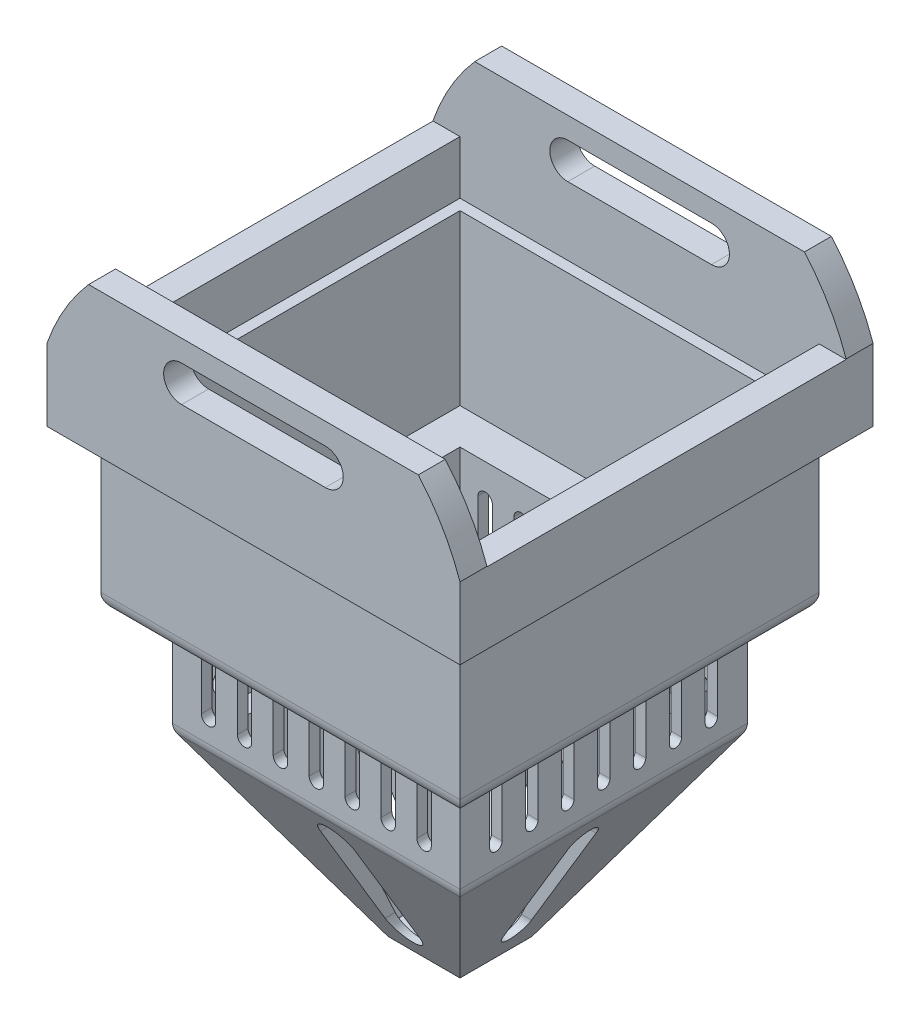
from build123d import *
from OCP.BRepFilletAPI import BRepFilletAPI_MakeChamfer

# Parameters (mm, degrees)
SKETCH4_W                       = 127
SKETCH4_H                       = 127
BOSS_EXTRUDE2_DEPTH             = 57.15
SKETCH4_3_W                     = 146.05
SKETCH4_3_H                     = 146.05
SKETCH4_3_W_2                   = 127
SKETCH4_3_H_2                   = 127
BOSS_EXTRUDE3_DEPTH             = 6.35
SKETCH4_4_W                     = 146.05
SKETCH4_4_H                     = 146.05
SKETCH4_4_W_2                   = 127
SKETCH4_4_H_2                   = 127
BOSS_EXTRUDE4_DEPTH             = 50.8
SKETCH7_W                       = 101.6
SKETCH7_H                       = 101.6
BOSS_EXTRUDE5_DEPTH             = 99.06
CHAMFER1_SIZE                   = 63.5
CHAMFER1_SIZE2                  = 38.1
SKETCH10_W                      = 119.38
SKETCH10_H                      = 119.38
CUT_EXTRUDE2_DEPTH              = 59.69
SKETCH12_W                      = 25.4
SKETCH12_H                      = 25.4
CUT_EXTRUDE3_DEPTH              = 99.06
SKETCH12_3_W                    = 93.98
SKETCH12_3_H                    = 93.98
SKETCH12_3_W_2                  = 25.4
SKETCH12_3_H_2                  = 25.4
CUT_EXTRUDE4_DEPTH              = 38.1
CHAMFER2_SIZE                   = 27.94
CHAMFER2_SIZE_2                 = 60.96
CHAMFER3_SIZE                   = 27.94
CHAMFER3_SIZE_2                 = 60.96
CUT_EXTRUDE6_DEPTH              = 105.918
CUT_EXTRUDE7_DEPTH              = 105.918
FILLET1_R                       = 6.35
CUT_EXTRUDE8_DEPTH              = 105.918
CUT_EXTRUDE9_DEPTH              = 105.918
CUT_EXTRUDE10_REACH             = 227.975
CUT_EXTRUDE10_DIRECTION_2_DEPTH = 226.975257993
CUT_EXTRUDE11_REACH             = 227.975
SKETCH18_W                      = 127
SKETCH18_H                      = 18.879254834
CUT_EXTRUDE12_REACH             = 227.975


with BuildPart() as part:
    # Sketch4 → Boss-Extrude2 (new body)
    with BuildSketch(Plane(origin=(0, 0, 0), x_dir=(1, 0, 0), z_dir=(0, 1, 0))):
        Rectangle(SKETCH4_W, SKETCH4_H)
    extrude(amount=-BOSS_EXTRUDE2_DEPTH)

    # Sketch4<3> → Boss-Extrude3 (add)
    # profile 1 of 2: a face of its own
    with BuildSketch(Plane(origin=(0, 0, 0), x_dir=(1, 0, 0), z_dir=(0, 1, 0))):
        Rectangle(SKETCH4_3_W, SKETCH4_3_H)
        Rectangle(SKETCH4_3_W_2, SKETCH4_3_H_2, mode=Mode.SUBTRACT)
    # profile 2 of 2: a face of its own
    with BuildSketch(Plane(origin=(0, 0, 0), x_dir=(1, 0, 0), z_dir=(0, 1, 0))):
        Rectangle(SKETCH4_3_W_2, SKETCH4_3_H_2)
    extrude(amount=BOSS_EXTRUDE3_DEPTH)

    # Sketch4<4> → Boss-Extrude4 (add)
    with BuildSketch(Plane(origin=(0, 0, 0), x_dir=(1, 0, 0), z_dir=(0, 1, 0))):
        Rectangle(SKETCH4_4_W, SKETCH4_4_H)
        Rectangle(SKETCH4_4_W_2, SKETCH4_4_H_2, mode=Mode.SUBTRACT)
    extrude(amount=BOSS_EXTRUDE4_DEPTH)

    # Sketch7 → Boss-Extrude5 (add)
    with BuildSketch(Plane.XZ.offset(57.15)):
        Rectangle(SKETCH7_W, SKETCH7_H)
    extrude(amount=BOSS_EXTRUDE5_DEPTH)

    # Chamfer1: one chamfer whose edges measure the first distance from different faces: ONE call of the kernel's chamfer builder (chamfer() names one face for all edges)
    chamfer1_edges_1 = [part.edges().sort_by_distance(p)[0] for p in [
        (-50.8, -156.21, 0),
    ]]
    chamfer1_side_1 = [part.faces().sort_by_distance(p)[0] for p in [
        (-50.8, -106.68, 0),
    ]]
    chamfer1_edges_2 = [part.edges().sort_by_distance(p)[0] for p in [
        (0, -156.21, -50.8),
    ]]
    chamfer1_side_2 = [part.faces().sort_by_distance(p)[0] for p in [
        (0, -106.68, -50.8),
    ]]
    chamfer1_edges_3 = [part.edges().sort_by_distance(p)[0] for p in [
        (50.8, -156.21, 0),
    ]]
    chamfer1_side_3 = [part.faces().sort_by_distance(p)[0] for p in [
        (50.8, -106.68, 0),
    ]]
    chamfer1_edges_4 = [part.edges().sort_by_distance(p)[0] for p in [
        (0, -156.21, 50.8),
    ]]
    chamfer1_side_4 = [part.faces().sort_by_distance(p)[0] for p in [
        (0, -106.68, 50.8),
    ]]
    chamfer1 = BRepFilletAPI_MakeChamfer(part.part.solid().wrapped)
    for e in chamfer1_edges_1:
        chamfer1.Add(CHAMFER1_SIZE, CHAMFER1_SIZE2, e.wrapped, chamfer1_side_1[0].wrapped)  # the first distance lies on this face
    for e in chamfer1_edges_2:
        chamfer1.Add(CHAMFER1_SIZE, CHAMFER1_SIZE2, e.wrapped, chamfer1_side_2[0].wrapped)  # the first distance lies on this face
    for e in chamfer1_edges_3:
        chamfer1.Add(CHAMFER1_SIZE, CHAMFER1_SIZE2, e.wrapped, chamfer1_side_3[0].wrapped)  # the first distance lies on this face
    for e in chamfer1_edges_4:
        chamfer1.Add(CHAMFER1_SIZE, CHAMFER1_SIZE2, e.wrapped, chamfer1_side_4[0].wrapped)  # the first distance lies on this face
    add(Compound.cast(chamfer1.Shape()), mode=Mode.REPLACE)

    # Sketch10 → Cut-Extrude2 (cut)
    with BuildSketch(Plane(origin=(0, 6.35, 0), x_dir=(1, 0, 0), z_dir=(0, 1, 0))):
        Rectangle(SKETCH10_W, SKETCH10_H)
    extrude(amount=-CUT_EXTRUDE2_DEPTH, mode=Mode.SUBTRACT)

    # Sketch12 → Cut-Extrude3 (cut)
    with BuildSketch(Plane(origin=(0, -53.34, 0), x_dir=(1, 0, 0), z_dir=(0, 1, 0))):
        Rectangle(SKETCH12_W, SKETCH12_H)
    extrude(amount=-CUT_EXTRUDE3_DEPTH, mode=Mode.SUBTRACT)

    # Sketch12<3> → Cut-Extrude4 (cut)
    with BuildSketch(Plane(origin=(0, -53.34, 0), x_dir=(1, 0, 0), z_dir=(0, 1, 0))):
        Rectangle(SKETCH12_3_W, SKETCH12_3_H)
        Rectangle(SKETCH12_3_W_2, SKETCH12_3_H_2, mode=Mode.SUBTRACT)
    extrude(amount=-CUT_EXTRUDE4_DEPTH, mode=Mode.SUBTRACT)

    # Chamfer2
    chamfer2_edges_1 = [part.edges().sort_by_distance(p)[0] for p in [
        (0, -91.44, 12.7),
    ]]
    chamfer2_side_1 = [part.faces().sort_by_distance(p)[0] for p in [
        (0, -91.44, 13.2588),
    ]]
    chamfer2_edges_2 = [part.edges().sort_by_distance(p)[0] for p in [
        (0, -91.44, -12.7),
    ]]
    chamfer2_side_2 = [part.faces().sort_by_distance(p)[0] for p in [
        (0, -91.44, -13.2588),
    ]]
    chamfer2 = BRepFilletAPI_MakeChamfer(part.part.solid().wrapped)
    for e in chamfer2_edges_1:
        chamfer2.Add(CHAMFER2_SIZE - 0.0001, CHAMFER2_SIZE_2 - 0.0001, e.wrapped, chamfer2_side_1[0].wrapped)
    for e in chamfer2_edges_2:
        chamfer2.Add(CHAMFER2_SIZE - 0.0001, CHAMFER2_SIZE_2 - 0.0001, e.wrapped, chamfer2_side_2[0].wrapped)
    add(Compound.cast(chamfer2.Shape()), mode=Mode.REPLACE)  # a hair under: the kernel refuses the full size

    # Chamfer3
    chamfer3_edges_1 = [part.edges().sort_by_distance(p)[0] for p in [
        (-12.7, -91.44, 0),
    ]]
    chamfer3_side_1 = [part.faces().sort_by_distance(p)[0] for p in [
        (-13.2588, -91.44, 0),
    ]]
    chamfer3_edges_2 = [part.edges().sort_by_distance(p)[0] for p in [
        (12.7, -91.44, 0),
    ]]
    chamfer3_side_2 = [part.faces().sort_by_distance(p)[0] for p in [
        (13.2588, -91.44, 0),
    ]]
    chamfer3 = BRepFilletAPI_MakeChamfer(part.part.solid().wrapped)
    for e in chamfer3_edges_1:
        chamfer3.Add(CHAMFER3_SIZE - 0.0001, CHAMFER3_SIZE_2 - 0.0001, e.wrapped, chamfer3_side_1[0].wrapped)
    for e in chamfer3_edges_2:
        chamfer3.Add(CHAMFER3_SIZE - 0.0001, CHAMFER3_SIZE_2 - 0.0001, e.wrapped, chamfer3_side_2[0].wrapped)
    add(Compound.cast(chamfer3.Shape()), mode=Mode.REPLACE)  # a hair under: the kernel refuses the full size

    # Sketch9 → Cut-Extrude6 (cut)
    with BuildSketch(Plane.ZY.offset(50.8)):
        with BuildLine():
            Line((4.937234555, -105.41), (4.937234555, -143.51))
            ThreePointArc((4.937234555, -143.51), (0, -148.447234555), (-4.937234555, -143.51))
            Line((-4.937234555, -143.51), (-4.937234555, -105.41))
            ThreePointArc((-4.937234555, -105.41), (0, -100.472765445), (4.937234555, -105.41))
        make_face()
    extrude(amount=-CUT_EXTRUDE6_DEPTH, mode=Mode.SUBTRACT)

    # Sketch13 → Cut-Extrude7 (cut)
    with BuildSketch(Plane(origin=(0, 0, -50.8), x_dir=(-1, 0, 0), z_dir=(0, 0, -1))):
        with BuildLine():
            Line((6.166200317, -105.41), (6.166200317, -143.51))
            ThreePointArc((6.166200317, -143.51), (0, -149.676200317), (-6.166200317, -143.51))
            Line((-6.166200317, -143.51), (-6.166200317, -105.41))
            ThreePointArc((-6.166200317, -105.41), (0, -99.243799683), (6.166200317, -105.41))
        make_face()
    extrude(amount=-CUT_EXTRUDE7_DEPTH, mode=Mode.SUBTRACT)

    # Fillet1
    fillet1_edges = [part.edges().sort_by_distance(p)[0] for p in [
        (-63.5, -57.15, 0),
        (0, -57.15, 63.5),
        (63.5, -57.15, 0),
        (0, -57.15, -63.5),
        (0, -92.71, -50.8),
        (-50.8, -92.71, 0),
        (50.8, -92.71, 0),
        (0, -92.71, 50.8),
    ]]
    fillet(fillet1_edges, radius=FILLET1_R)

    # Sketch14 → Cut-Extrude8 (cut)
    with BuildSketch(Plane(origin=(50.8, 0, 0), x_dir=(0, 0, -1), z_dir=(1, 0, 0))):
        with BuildLine():
            Line((2.196719931, -64.525575911), (2.196719931, -83.575575911))
            ThreePointArc((2.196719931, -83.575575911), (0, -85.772295842), (-2.196719931, -83.575575911))
            Line((-2.196719931, -83.575575911), (-2.196719931, -64.525575911))
            ThreePointArc((-2.196719931, -64.525575911), (0, -62.328855981), (2.196719931, -64.525575911))
        make_face()
        with BuildLine():
            Line((14.896719931, -64.525575911), (14.896719931, -83.575575911))
            ThreePointArc((14.896719931, -83.575575911), (12.7, -85.772295842), (10.503280069, -83.575575911))
            Line((10.503280069, -83.575575911), (10.503280069, -64.525575911))
            ThreePointArc((10.503280069, -64.525575911), (12.7, -62.328855981), (14.896719931, -64.525575911))
        make_face()
        with BuildLine():
            Line((27.596719931, -64.525575911), (27.596719931, -83.575575911))
            ThreePointArc((27.596719931, -83.575575911), (25.4, -85.772295842), (23.203280069, -83.575575911))
            Line((23.203280069, -83.575575911), (23.203280069, -64.525575911))
            ThreePointArc((23.203280069, -64.525575911), (25.4, -62.328855981), (27.596719931, -64.525575911))
        make_face()
        with BuildLine():
            Line((40.296719931, -64.525575911), (40.296719931, -83.575575911))
            ThreePointArc((40.296719931, -83.575575911), (38.1, -85.772295842), (35.903280069, -83.575575911))
            Line((35.903280069, -83.575575911), (35.903280069, -64.525575911))
            ThreePointArc((35.903280069, -64.525575911), (38.1, -62.328855981), (40.296719931, -64.525575911))
        make_face()
        with BuildLine():
            Line((-10.503280069, -64.525575911), (-10.503280069, -83.575575911))
            ThreePointArc((-10.503280069, -83.575575911), (-12.7, -85.772295842), (-14.896719931, -83.575575911))
            Line((-14.896719931, -83.575575911), (-14.896719931, -64.525575911))
            ThreePointArc((-14.896719931, -64.525575911), (-12.7, -62.328855981), (-10.503280069, -64.525575911))
        make_face()
        with BuildLine():
            Line((-23.203280069, -64.525575911), (-23.203280069, -83.575575911))
            ThreePointArc((-23.203280069, -83.575575911), (-25.4, -85.772295842), (-27.596719931, -83.575575911))
            Line((-27.596719931, -83.575575911), (-27.596719931, -64.525575911))
            ThreePointArc((-27.596719931, -64.525575911), (-25.4, -62.328855981), (-23.203280069, -64.525575911))
        make_face()
        with BuildLine():
            Line((-35.903280069, -64.525575911), (-35.903280069, -83.575575911))
            ThreePointArc((-35.903280069, -83.575575911), (-38.1, -85.772295842), (-40.296719931, -83.575575911))
            Line((-40.296719931, -83.575575911), (-40.296719931, -64.525575911))
            ThreePointArc((-40.296719931, -64.525575911), (-38.1, -62.328855981), (-35.903280069, -64.525575911))
        make_face()
    extrude(amount=-CUT_EXTRUDE8_DEPTH, mode=Mode.SUBTRACT)

    # Sketch16 → Cut-Extrude9 (cut)
    with BuildSketch(Plane.XY.offset(50.8)):
        with BuildLine():
            Line((2.54, -65.160575911), (2.54, -82.940575911))
            ThreePointArc((2.54, -82.940575911), (0, -85.480575911), (-2.54, -82.940575911))
            Line((-2.54, -82.940575911), (-2.54, -65.160575911))
            ThreePointArc((-2.54, -65.160575911), (0, -62.620575911), (2.54, -65.160575911))
        make_face()
        with BuildLine():
            Line((15.24, -65.160575911), (15.24, -82.940575911))
            ThreePointArc((15.24, -82.940575911), (12.7, -85.480575911), (10.16, -82.940575911))
            Line((10.16, -82.940575911), (10.16, -65.160575911))
            ThreePointArc((10.16, -65.160575911), (12.7, -62.620575911), (15.24, -65.160575911))
        make_face()
        with BuildLine():
            Line((27.94, -65.160575911), (27.94, -82.940575911))
            ThreePointArc((27.94, -82.940575911), (25.4, -85.480575911), (22.86, -82.940575911))
            Line((22.86, -82.940575911), (22.86, -65.160575911))
            ThreePointArc((22.86, -65.160575911), (25.4, -62.620575911), (27.94, -65.160575911))
        make_face()
        with BuildLine():
            Line((40.64, -65.160575911), (40.64, -82.940575911))
            ThreePointArc((40.64, -82.940575911), (38.1, -85.480575911), (35.56, -82.940575911))
            Line((35.56, -82.940575911), (35.56, -65.160575911))
            ThreePointArc((35.56, -65.160575911), (38.1, -62.620575911), (40.64, -65.160575911))
        make_face()
        with BuildLine():
            Line((-10.16, -65.160575911), (-10.16, -82.940575911))
            ThreePointArc((-10.16, -82.940575911), (-12.7, -85.480575911), (-15.24, -82.940575911))
            Line((-15.24, -82.940575911), (-15.24, -65.160575911))
            ThreePointArc((-15.24, -65.160575911), (-12.7, -62.620575911), (-10.16, -65.160575911))
        make_face()
        with BuildLine():
            Line((-22.86, -65.160575911), (-22.86, -82.940575911))
            ThreePointArc((-22.86, -82.940575911), (-25.4, -85.480575911), (-27.94, -82.940575911))
            Line((-27.94, -82.940575911), (-27.94, -65.160575911))
            ThreePointArc((-27.94, -65.160575911), (-25.4, -62.620575911), (-22.86, -65.160575911))
        make_face()
        with BuildLine():
            Line((-35.56, -65.160575911), (-35.56, -82.940575911))
            ThreePointArc((-35.56, -82.940575911), (-38.1, -85.480575911), (-40.64, -82.940575911))
            Line((-40.64, -82.940575911), (-40.64, -65.160575911))
            ThreePointArc((-40.64, -65.160575911), (-38.1, -62.620575911), (-35.56, -65.160575911))
        make_face()
    extrude(amount=-CUT_EXTRUDE9_DEPTH, mode=Mode.SUBTRACT)

    # Cut-Extrude10: up to this face of the body (flat: up to its plane)
    cut_extrude10_end = Plane(part.part.faces().sort_by_distance((0, 25.4, -73.025))[0])
    # Sketch17 → Cut-Extrude10 (cut, up to the picked face)
    with BuildSketch(Plane.XY.offset(73.025), mode=Mode.PRIVATE) as cut_extrude10_sk1:
        with BuildLine():
            Line((-73.025, 25.4), (-73.025, 85.829137007))
            Line((-73.025, 85.829137007), (73.025, 85.829137007))
            Line((73.025, 85.829137007), (73.025, 25.4))
            ThreePointArc((73.025, 25.4), (0, 77.316302453), (-73.025, 25.4))
        make_face()
    cut_extrude10_tool1 = split(extrude(cut_extrude10_sk1.sketch, amount=-CUT_EXTRUDE10_REACH, mode=Mode.PRIVATE), bisect_by=cut_extrude10_end, keep=Keep.BOTH, mode=Mode.PRIVATE)
    add(cut_extrude10_tool1.solids().sort_by(Axis((-71.444422, 55.614569, 73.025), (0, 0, -1)))[0], mode=Mode.SUBTRACT)

    # Sketch17 → Cut-Extrude10 direction 2 (cut)
    with BuildSketch(Plane.XY.offset(73.025)):
        with BuildLine():
            Line((-73.025, 25.4), (-73.025, 85.829137007))
            Line((-73.025, 85.829137007), (73.025, 85.829137007))
            Line((73.025, 85.829137007), (73.025, 25.4))
            ThreePointArc((73.025, 25.4), (0, 77.316302453), (-73.025, 25.4))
        make_face()
    extrude(amount=CUT_EXTRUDE10_DIRECTION_2_DEPTH, mode=Mode.SUBTRACT)

    # Cut-Extrude11: up to this face of the body (flat: up to its plane)
    cut_extrude11_end = Plane(part.part.faces().sort_by_distance((-73.025, 12.7, 0))[0])
    # Sketch18 → Cut-Extrude11 (cut, up to the picked face)
    with BuildSketch(Plane(origin=(73.025, 0, 0), x_dir=(0, 0, -1), z_dir=(1, 0, 0)), mode=Mode.PRIVATE) as cut_extrude11_sk1:
        with Locations((0, 34.66888225)):
            Rectangle(SKETCH18_W, SKETCH18_H)
    cut_extrude11_tool1 = split(extrude(cut_extrude11_sk1.sketch, amount=-CUT_EXTRUDE11_REACH, mode=Mode.PRIVATE), bisect_by=cut_extrude11_end, keep=Keep.BOTH, mode=Mode.PRIVATE)
    add(cut_extrude11_tool1.solids().sort_by(Axis((73.025, 34.668882, 0), (-1, 0, 0)))[0], mode=Mode.SUBTRACT)

    # Cut-Extrude12: up to this face of the body (flat: up to its plane)
    cut_extrude12_end = Plane(part.part.faces().sort_by_distance((0, 24.608038246, -73.025))[0])
    # Sketch19 → Cut-Extrude12 (cut, up to the picked face)
    with BuildSketch(Plane.XY.offset(73.025), mode=Mode.PRIVATE) as cut_extrude12_sk1:
        with BuildLine():
            Line((-25.4, 43.18), (25.4, 43.18))
            ThreePointArc((25.4, 43.18), (31.75, 36.83), (25.4, 30.48))
            Line((25.4, 30.48), (-25.4, 30.48))
            ThreePointArc((-25.4, 30.48), (-31.75, 36.83), (-25.4, 43.18))
        make_face()
    cut_extrude12_tool1 = split(extrude(cut_extrude12_sk1.sketch, amount=-CUT_EXTRUDE12_REACH, mode=Mode.PRIVATE), bisect_by=cut_extrude12_end, keep=Keep.BOTH, mode=Mode.PRIVATE)
    add(cut_extrude12_tool1.solids().sort_by(Axis((0, 36.83, 73.025), (0, 0, -1)))[0], mode=Mode.SUBTRACT)


solid = part.part
